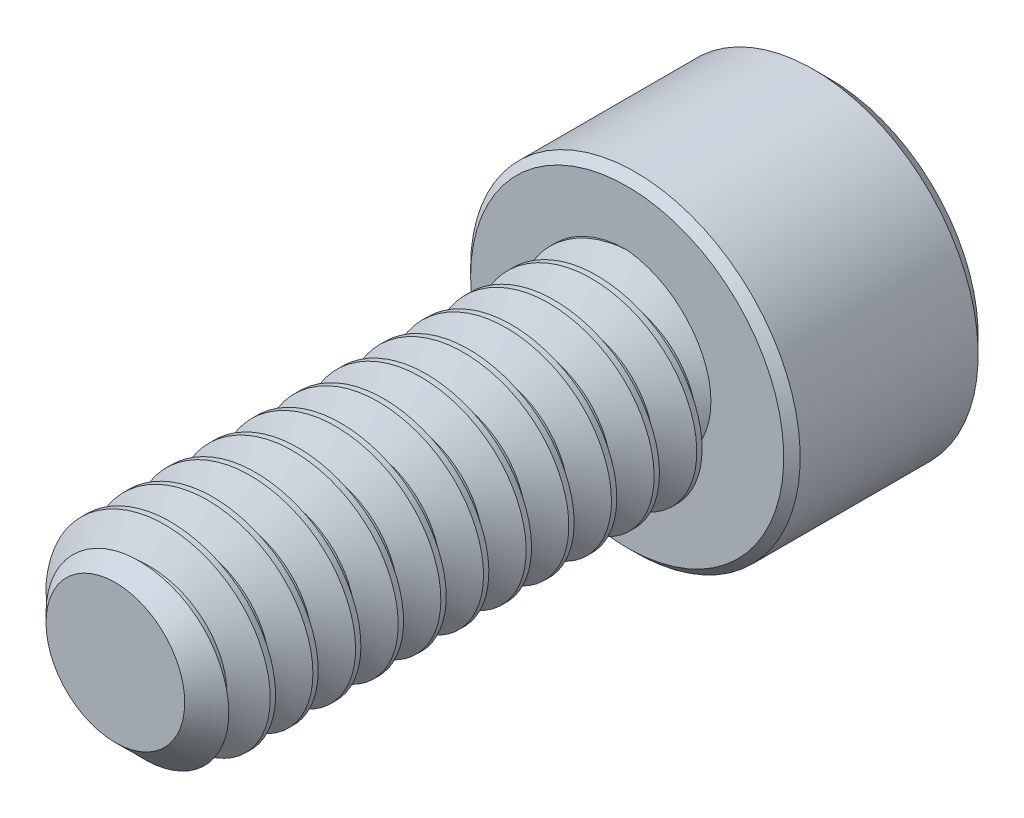
from build123d import *

# Parameters (mm, degrees)
SKETCH1_R          = 1.2573
EXTRUDE1_DEPTH     = 6.35
CHAMFER3_SIZE      = 0.396875
CUT_SWEEP1_PITCH   = 0.529166667
SKETCH6_R          = 2.0447
EXTRUDE2_DEPTH     = 2.5146
CUT_EXTRUDE1_DEPTH = 1.48828125
CHAMFER1_SIZE      = 0.20447
CHAMFER2_SIZE      = 0.102235


with BuildPart() as part:
    # Sketch1 → Extrude1 (new body)
    with BuildSketch(Plane.XY):
        Circle(SKETCH1_R)
    extrude(amount=-EXTRUDE1_DEPTH)

    # Chamfer3
    chamfer3_edges = [part.edges().sort_by_distance(p)[0] for p in [
        (-1.2573, 0, 0),
    ]]
    chamfer(chamfer3_edges, length=CHAMFER3_SIZE)

    # Cut-Sweep1: the profile of Sketch3 profile screwed along a right-hand helix of 13 turns, 6 arcs to a turn; built about Z, then put on its axis
    cut_sweep1_z = Axis((0, 0, 0), (0, 0, 1))
    cut_sweep1_corners = [(1.2576, 0, -0.463194038), (0.913596168, 0, -0.264583333), (0.913596168, 0, -0.1984375), (1.2576, 0, 0.000173205)]
    with BuildLine(mode=Mode.PRIVATE) as cut_sweep1_profile:
        Line(cut_sweep1_corners[0], cut_sweep1_corners[1])
        Line(cut_sweep1_corners[1], cut_sweep1_corners[2])
        Line(cut_sweep1_corners[2], cut_sweep1_corners[3])
        Line(cut_sweep1_corners[3], cut_sweep1_corners[0])
    cut_sweep1_cap = Face(cut_sweep1_profile.wire())
    cut_sweep1_turn_angles = [0, 30, 60, 90, 120, 150, 180, 210, 240, 270, 300, 330, 360]
    cut_sweep1_turn_weights = [1, 0.8660254037844387, 1, 0.8660254037844387, 1, 0.8660254037844387, 1, 0.8660254037844387, 1, 0.8660254037844387, 1, 0.8660254037844387, 1]
    cut_sweep1_turn_rails = [Edge.make_bspline([Vector(p[0], p[1], 0).rotate(cut_sweep1_z, cut_sweep1_turn_angles[k]) / cut_sweep1_turn_weights[k] + Vector(0, 0, p[2] + CUT_SWEEP1_PITCH * cut_sweep1_turn_angles[k] / 360) for k in range(13)], [0, 0, 0, 1, 1, 2, 2, 3, 3, 4, 4, 5, 5, 6, 6, 6], 2, cut_sweep1_turn_weights) for p in cut_sweep1_corners]
    cut_sweep1_turn_sides = [Face.make_surface_from_curves(cut_sweep1_turn_rails[p[0]], cut_sweep1_turn_rails[p[1]]) for p in [(0, 1), (1, 2), (2, 3), (3, 0)]]
    cut_sweep1 = Plane(origin=(0, 0, 0), x_dir=(0, 1, 0), z_dir=(0, 0, -1)) * Solid(Shell([*[p.moved(Location((0, 0, CUT_SWEEP1_PITCH * i))) for i in range(13) for p in cut_sweep1_turn_sides], cut_sweep1_cap, cut_sweep1_cap.rotate(cut_sweep1_z, 4680).moved(Location((0, 0, CUT_SWEEP1_PITCH * 4680 / 360)))]))
    add(cut_sweep1, mode=Mode.SUBTRACT)

    # Sketch6 → Extrude2 (add)
    with BuildSketch(Plane(origin=(0, 0, -6.35), x_dir=(-1, 0, 0), z_dir=(0, 0, -1))):
        Circle(SKETCH6_R)
    extrude(amount=EXTRUDE2_DEPTH)

    # Sketch7 → Cut-Extrude1 (cut)
    with BuildSketch(Plane(origin=(0, 0, -8.8646), x_dir=(-1, 0, 0), z_dir=(0, 0, -1))):
        Polygon((0, 1.14567944), (-0.9921875, 0.57283972), (-0.9921875, -0.57283972), (0, -1.14567944), (0.9921875, -0.57283972), (0.9921875, 0.57283972), align=None)
    extrude(amount=-CUT_EXTRUDE1_DEPTH, mode=Mode.SUBTRACT)

    # Cut-Extrude2 cone 1 section (through the dimple's axis) → Cut-Extrude2 (revolve, cut)
    with BuildSketch(Plane(origin=(0, 0, -8.8646), x_dir=(0, 1, 0), z_dir=(1, 0, 0))):
        Polygon((0, 0), (1.14567944, 0), (0, 1.14567944), align=None)
    revolve(axis=Axis((0, 0, -8.8646), (0, 0, 1)), mode=Mode.SUBTRACT)

    # Chamfer1
    chamfer1_edges = [part.edges().sort_by_distance(p)[0] for p in [
        (2.0447, 0, -8.8646),
    ]]
    chamfer(chamfer1_edges, length=CHAMFER1_SIZE)

    # Chamfer2
    chamfer2_edges = [part.edges().sort_by_distance(p)[0] for p in [
        (2.0447, 0, -6.35),
    ]]
    chamfer(chamfer2_edges, length=CHAMFER2_SIZE)


solid = part.part
